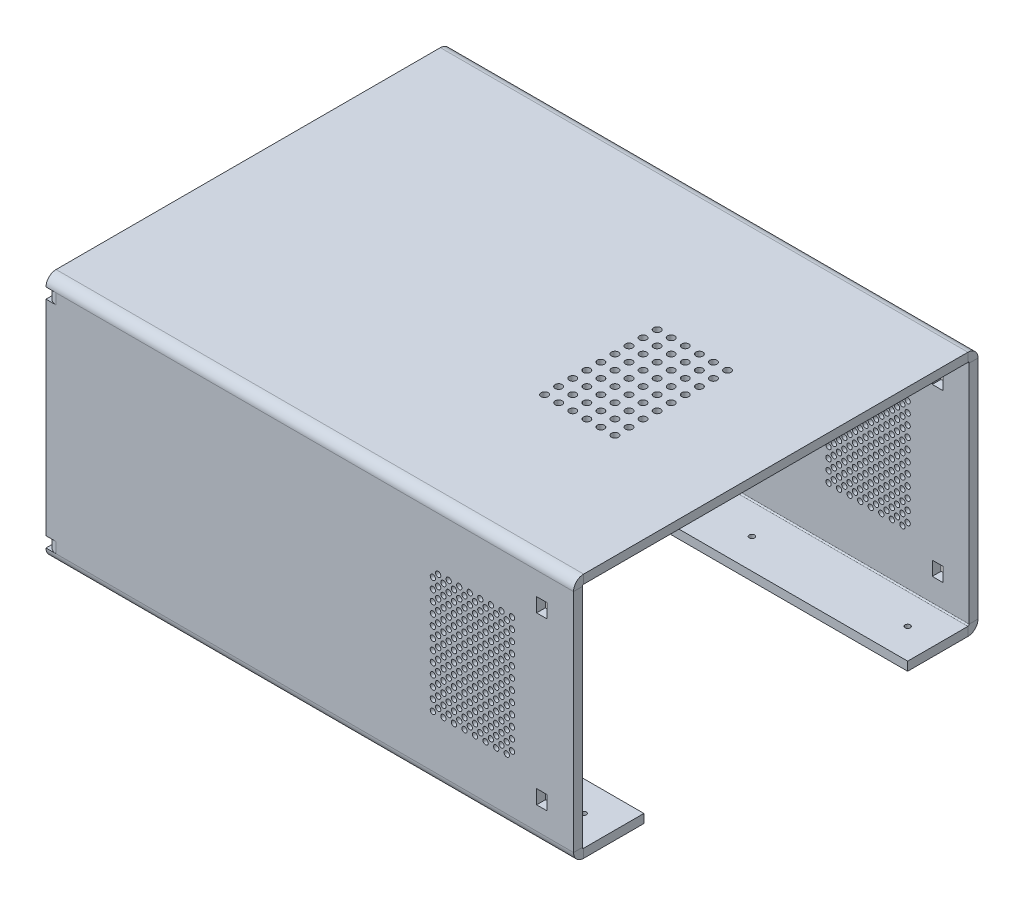
from build123d import *

# Parameters (mm, degrees)
SKETCH1_W                         = 300
SKETCH1_H                         = 220
TOP_SURFACE_DEPTH                 = 5
SIDES_STRIP_W                     = 21.4732
SIDES_STRIP_H                     = 5
SIDES_STRIP_CUT_DEPTH             = 300
SIDES_STRIP_2_W                   = 21.4732
SIDES_STRIP_2_H                   = 5
SIDES_STRIP_CUT_2_DEPTH           = 300
SIDES_DEPTH                       = 300
SIDES_BEND_DEPTH                  = 300
BOTTOM_SURFACES_STRIP_W           = 21.4732
BOTTOM_SURFACES_STRIP_H           = 5
BOTTOM_SURFACES_STRIP_CUT_DEPTH   = 300
BOTTOM_SURFACES_STRIP_2_W         = 21.4732
BOTTOM_SURFACES_STRIP_2_H         = 5
BOTTOM_SURFACES_STRIP_CUT_2_DEPTH = 300
BOTTOM_SURFACES_DEPTH             = 300
BOTTOM_SURFACES_BEND_DEPTH        = 300
SKETCH27_R                        = 1.5
SCREW_HOLES_BOTTOM_DEPTH          = 5
EDGE_FLANGE4_STRIP_W              = 21.4732
EDGE_FLANGE4_STRIP_H              = 5
EDGE_FLANGE4_STRIP_CUT_DEPTH      = 6
EDGE_FLANGE4_DEPTH                = 6
EDGE_FLANGE5_STRIP_W              = 21.4732
EDGE_FLANGE5_STRIP_H              = 5
EDGE_FLANGE5_STRIP_CUT_DEPTH      = 6
EDGE_FLANGE5_DEPTH                = 6
EDGE_FLANGE6_STRIP_W              = 21.4732
EDGE_FLANGE6_STRIP_H              = 5
EDGE_FLANGE6_STRIP_CUT_DEPTH      = 6
EDGE_FLANGE6_DEPTH                = 6
EDGE_FLANGE7_STRIP_W              = 21.4732
EDGE_FLANGE7_STRIP_H              = 5
EDGE_FLANGE7_STRIP_CUT_DEPTH      = 6
EDGE_FLANGE7_DEPTH                = 6
SKETCH40_R                        = 1.5
CUT_EXTRUDE3_DEPTH                = 5
SKETCH42_R                        = 1.5
SIDE_AIR_VENTS_DEPTH              = 404.112887415
SKETCH46_R                        = 2
TOP_AIR_VENTS_DEPTH               = 5
SNAP_HOOK_GROVES_REACH            = 405.113
SKETCH43_W                        = 6
SKETCH43_H                        = 8


# Sheet-metal steps are written as plain solids
with BuildPart() as part:
    # Sketch1 → Top Surface (new body)
    with BuildSketch(Plane(origin=(0, 0, 0), x_dir=(1, 0, 0), z_dir=(0, 1, 0))):
        with Locations((150, -110)):
            Rectangle(SKETCH1_W, SKETCH1_H)
    extrude(amount=-TOP_SURFACE_DEPTH)

    # Sides strip (across the edge) → Sides strip cut (cut)
    with BuildSketch(Plane(origin=(300, -5, 220), x_dir=(0, 0, -1), z_dir=(-1, 0, 0))):
        with Locations((-10, -2.5)):
            Rectangle(SIDES_STRIP_W, SIDES_STRIP_H)
    extrude(amount=SIDES_STRIP_CUT_DEPTH, mode=Mode.SUBTRACT)

    # Sides strip 2 (across the edge) → Sides strip cut 2 (cut)
    with BuildSketch(Plane(origin=(0, -5, 0), x_dir=(0, 0, 1), z_dir=(1, 0, 0))):
        with Locations((-10, -2.5)):
            Rectangle(SIDES_STRIP_2_W, SIDES_STRIP_2_H)
    extrude(amount=SIDES_STRIP_CUT_2_DEPTH, mode=Mode.SUBTRACT)

    # Sides section (across the edge) → Sides (add)
    with BuildSketch(Plane(origin=(300, -5, 220), x_dir=(0, 0, -1), z_dir=(-1, 0, 0))):
        with BuildLine():
            Line((-5, 0.7366), (-5, 135))
            Line((-5, 135), (0, 135))
            Line((0, 135), (0, 0.7366))
            ThreePointArc((0, 0.7366), (0.215745145, 0.215745145), (0.7366, 0))
            Line((0.7366, 0), (0.7366, -5))
            ThreePointArc((0.7366, -5), (-3.319788761, -3.319788761), (-5, 0.7366))
        make_face()
    extrude(amount=SIDES_DEPTH)

    # Sides section 2 (across the edge) → Sides bend (add)
    with BuildSketch(Plane(origin=(0, -5, 0), x_dir=(0, 0, 1), z_dir=(1, 0, 0))):
        with BuildLine():
            Line((-5, 0.7366), (-5, 135))
            Line((-5, 135), (0, 135))
            Line((0, 135), (0, 0.7366))
            ThreePointArc((0, 0.7366), (0.215745145, 0.215745145), (0.7366, 0))
            Line((0.7366, 0), (0.7366, -5))
            ThreePointArc((0.7366, -5), (-3.319788761, -3.319788761), (-5, 0.7366))
        make_face()
    extrude(amount=SIDES_BEND_DEPTH)

    # Bottom surfaces strip (across the edge) → Bottom surfaces strip cut (cut)
    with BuildSketch(Plane(origin=(300, -140, 220), x_dir=(0, 1, 0), z_dir=(-1, 0, 0))):
        with Locations((-5, -2.5)):
            Rectangle(BOTTOM_SURFACES_STRIP_W, BOTTOM_SURFACES_STRIP_H)
    extrude(amount=BOTTOM_SURFACES_STRIP_CUT_DEPTH, mode=Mode.SUBTRACT)

    # Bottom surfaces strip 2 (across the edge) → Bottom surfaces strip cut 2 (cut)
    with BuildSketch(Plane(origin=(0, -140, 0), x_dir=(0, 1, 0), z_dir=(1, 0, 0))):
        with Locations((-5, -2.5)):
            Rectangle(BOTTOM_SURFACES_STRIP_2_W, BOTTOM_SURFACES_STRIP_2_H)
    extrude(amount=BOTTOM_SURFACES_STRIP_CUT_2_DEPTH, mode=Mode.SUBTRACT)

    # Bottom surfaces section (across the edge) → Bottom surfaces (add)
    with BuildSketch(Plane(origin=(300, -140, 220), x_dir=(0, 1, 0), z_dir=(-1, 0, 0))):
        with BuildLine():
            Line((0, 0.7366), (0, 35))
            Line((0, 35), (5, 35))
            Line((5, 35), (5, 0.7366))
            ThreePointArc((5, 0.7366), (5.215745145, 0.215745145), (5.7366, 0))
            Line((5.7366, 0), (5.7366, -5))
            ThreePointArc((5.7366, -5), (1.680211239, -3.319788761), (0, 0.7366))
        make_face()
    extrude(amount=BOTTOM_SURFACES_DEPTH)

    # Bottom surfaces section 2 (across the edge) → Bottom surfaces bend (add)
    with BuildSketch(Plane(origin=(0, -140, 0), x_dir=(0, 1, 0), z_dir=(1, 0, 0))):
        with BuildLine():
            Line((0, 0.7366), (0, 35))
            Line((0, 35), (5, 35))
            Line((5, 35), (5, 0.7366))
            ThreePointArc((5, 0.7366), (5.215745145, 0.215745145), (5.7366, 0))
            Line((5.7366, 0), (5.7366, -5))
            ThreePointArc((5.7366, -5), (1.680211239, -3.319788761), (0, 0.7366))
        make_face()
    extrude(amount=BOTTOM_SURFACES_BEND_DEPTH)

    # Sketch27 → Screw Holes Bottom (cut)
    with BuildSketch(Plane(origin=(0, -135, 0), x_dir=(1, 0, 0), z_dir=(0, 1, 0))):
        with Locations(Location((17.1317, -17.8683, 0), (0, 0, 270))):
            Circle(SKETCH27_R)
        with Locations(Location((105.710566667, -17.8683, 0), (0, 0, 270))):
            Circle(SKETCH27_R)
        with Locations(Location((194.289433333, -17.8683, 0), (0, 0, 270))):
            Circle(SKETCH27_R)
        with Locations(Location((282.8683, -17.8683, 0), (0, 0, 270))):
            Circle(SKETCH27_R)
        with Locations(Location((17.1317, -202.1317, 0), (0, 0, 270))):
            Circle(SKETCH27_R)
        with Locations(Location((105.710566667, -202.1317, 0), (0, 0, 270))):
            Circle(SKETCH27_R)
        with Locations(Location((194.289433333, -202.1317, 0), (0, 0, 270))):
            Circle(SKETCH27_R)
        with Locations(Location((282.8683, -202.1317, 0), (0, 0, 270))):
            Circle(SKETCH27_R)
    extrude(amount=-SCREW_HOLES_BOTTOM_DEPTH, mode=Mode.SUBTRACT)

    # Edge-Flange4 strip (across the edge) → Edge-Flange4 strip cut (cut)
    with BuildSketch(Plane(origin=(0, -11.7366, 220), x_dir=(1, 0, 0), z_dir=(0, 1, 0))):
        with Locations((-5, -2.5)):
            Rectangle(EDGE_FLANGE4_STRIP_W, EDGE_FLANGE4_STRIP_H)
    extrude(amount=EDGE_FLANGE4_STRIP_CUT_DEPTH, mode=Mode.SUBTRACT)

    # Edge-Flange4 section (across the edge) → Edge-Flange4 (add)
    with BuildSketch(Plane(origin=(0, -11.7366, 220), x_dir=(1, 0, 0), z_dir=(0, 1, 0))):
        with BuildLine():
            Line((0, 0.7366), (0, 6))
            Line((0, 6), (5, 6))
            Line((5, 6), (5, 0.7366))
            ThreePointArc((5, 0.7366), (5.215745145, 0.215745145), (5.7366, 0))
            Line((5.7366, 0), (5.7366, -5))
            ThreePointArc((5.7366, -5), (1.680211239, -3.319788761), (0, 0.7366))
        make_face()
    extrude(amount=EDGE_FLANGE4_DEPTH)

    # Edge-Flange5 strip (across the edge) → Edge-Flange5 strip cut (cut)
    with BuildSketch(Plane(origin=(0, -134.2634, 220), x_dir=(1, 0, 0), z_dir=(0, 1, 0))):
        with Locations((-5, -2.5)):
            Rectangle(EDGE_FLANGE5_STRIP_W, EDGE_FLANGE5_STRIP_H)
    extrude(amount=EDGE_FLANGE5_STRIP_CUT_DEPTH, mode=Mode.SUBTRACT)

    # Edge-Flange5 section (across the edge) → Edge-Flange5 (add)
    with BuildSketch(Plane(origin=(0, -134.2634, 220), x_dir=(1, 0, 0), z_dir=(0, 1, 0))):
        with BuildLine():
            Line((0, 0.7366), (0, 6))
            Line((0, 6), (5, 6))
            Line((5, 6), (5, 0.7366))
            ThreePointArc((5, 0.7366), (5.215745145, 0.215745145), (5.7366, 0))
            Line((5.7366, 0), (5.7366, -5))
            ThreePointArc((5.7366, -5), (1.680211239, -3.319788761), (0, 0.7366))
        make_face()
    extrude(amount=EDGE_FLANGE5_DEPTH)

    # Edge-Flange6 strip (across the edge) → Edge-Flange6 strip cut (cut)
    with BuildSketch(Plane.XZ.offset(128.2634)):
        with Locations((-5, -2.5)):
            Rectangle(EDGE_FLANGE6_STRIP_W, EDGE_FLANGE6_STRIP_H)
    extrude(amount=EDGE_FLANGE6_STRIP_CUT_DEPTH, mode=Mode.SUBTRACT)

    # Edge-Flange6 section (across the edge) → Edge-Flange6 (add)
    with BuildSketch(Plane.XZ.offset(128.2634)):
        with BuildLine():
            Line((0, 0.7366), (0, 6))
            Line((0, 6), (5, 6))
            Line((5, 6), (5, 0.7366))
            ThreePointArc((5, 0.7366), (5.215745145, 0.215745145), (5.7366, 0))
            Line((5.7366, 0), (5.7366, -5))
            ThreePointArc((5.7366, -5), (1.680211239, -3.319788761), (0, 0.7366))
        make_face()
    extrude(amount=EDGE_FLANGE6_DEPTH)

    # Edge-Flange7 strip (across the edge) → Edge-Flange7 strip cut (cut)
    with BuildSketch(Plane.XZ.offset(5.7366)):
        with Locations((-5, -2.5)):
            Rectangle(EDGE_FLANGE7_STRIP_W, EDGE_FLANGE7_STRIP_H)
    extrude(amount=EDGE_FLANGE7_STRIP_CUT_DEPTH, mode=Mode.SUBTRACT)

    # Edge-Flange7 section (across the edge) → Edge-Flange7 (add)
    with BuildSketch(Plane.XZ.offset(5.7366)):
        with BuildLine():
            Line((0, 0.7366), (0, 6))
            Line((0, 6), (5, 6))
            Line((5, 6), (5, 0.7366))
            ThreePointArc((5, 0.7366), (5.215745145, 0.215745145), (5.7366, 0))
            Line((5.7366, 0), (5.7366, -5))
            ThreePointArc((5.7366, -5), (1.680211239, -3.319788761), (0, 0.7366))
        make_face()
    extrude(amount=EDGE_FLANGE7_DEPTH)

    # Sketch40 → Cut-Extrude3 (cut)
    with BuildSketch(Plane.ZY):
        with Locations((3.3683, -8.7366)):
            Circle(SKETCH40_R)
        with Locations((3.3683, -131.2634)):
            Circle(SKETCH40_R)
        with Locations((216.6317, -8.7366)):
            Circle(SKETCH40_R)
        with Locations((216.6317, -131.2634)):
            Circle(SKETCH40_R)
    extrude(amount=-CUT_EXTRUDE3_DEPTH, mode=Mode.SUBTRACT)

    # Sketch42 → Side Air Vents (cut, through all)
    with BuildSketch(Plane(origin=(0, 0, -5), x_dir=(-1, 0, 0), z_dir=(0, 0, -1))):
        with Locations(Location((-265, -35.7366, 0), (0, 0, 90))):
            Circle(SKETCH42_R)
        with Locations(Location((-259, -35.7366, 0), (0, 0, 90))):
            Circle(SKETCH42_R)
        with Locations(Location((-253, -35.7366, 0), (0, 0, 90))):
            Circle(SKETCH42_R)
        with Locations(Location((-247, -35.7366, 0), (0, 0, 90))):
            Circle(SKETCH42_R)
        with Locations(Location((-241, -35.7366, 0), (0, 0, 90))):
            Circle(SKETCH42_R)
        with Locations(Location((-235, -35.7366, 0), (0, 0, 90))):
            Circle(SKETCH42_R)
        with Locations(Location((-229, -35.7366, 0), (0, 0, 90))):
            Circle(SKETCH42_R)
        with Locations(Location((-223, -35.7366, 0), (0, 0, 90))):
            Circle(SKETCH42_R)
        with Locations(Location((-262, -38.7366, 0), (0, 0, 90))):
            Circle(SKETCH42_R)
        with Locations(Location((-256, -38.7366, 0), (0, 0, 90))):
            Circle(SKETCH42_R)
        with Locations(Location((-250, -38.7366, 0), (0, 0, 90))):
            Circle(SKETCH42_R)
        with Locations(Location((-244, -38.7366, 0), (0, 0, 90))):
            Circle(SKETCH42_R)
        with Locations(Location((-238, -38.7366, 0), (0, 0, 90))):
            Circle(SKETCH42_R)
        with Locations(Location((-232, -38.7366, 0), (0, 0, 90))):
            Circle(SKETCH42_R)
        with Locations(Location((-226, -38.7366, 0), (0, 0, 90))):
            Circle(SKETCH42_R)
        with Locations(Location((-220, -38.7366, 0), (0, 0, 90))):
            Circle(SKETCH42_R)
        with Locations(Location((-265, -41.7366, 0), (0, 0, 90))):
            Circle(SKETCH42_R)
        with Locations(Location((-259, -41.7366, 0), (0, 0, 90))):
            Circle(SKETCH42_R)
        with Locations(Location((-253, -41.7366, 0), (0, 0, 90))):
            Circle(SKETCH42_R)
        with Locations(Location((-247, -41.7366, 0), (0, 0, 90))):
            Circle(SKETCH42_R)
        with Locations(Location((-241, -41.7366, 0), (0, 0, 90))):
            Circle(SKETCH42_R)
        with Locations(Location((-235, -41.7366, 0), (0, 0, 90))):
            Circle(SKETCH42_R)
        with Locations(Location((-229, -41.7366, 0), (0, 0, 90))):
            Circle(SKETCH42_R)
        with Locations(Location((-223, -41.7366, 0), (0, 0, 90))):
            Circle(SKETCH42_R)
        with Locations(Location((-262, -44.7366, 0), (0, 0, 90))):
            Circle(SKETCH42_R)
        with Locations(Location((-256, -44.7366, 0), (0, 0, 90))):
            Circle(SKETCH42_R)
        with Locations(Location((-250, -44.7366, 0), (0, 0, 90))):
            Circle(SKETCH42_R)
        with Locations(Location((-244, -44.7366, 0), (0, 0, 90))):
            Circle(SKETCH42_R)
        with Locations(Location((-238, -44.7366, 0), (0, 0, 90))):
            Circle(SKETCH42_R)
        with Locations(Location((-232, -44.7366, 0), (0, 0, 90))):
            Circle(SKETCH42_R)
        with Locations(Location((-226, -44.7366, 0), (0, 0, 90))):
            Circle(SKETCH42_R)
        with Locations(Location((-220, -44.7366, 0), (0, 0, 90))):
            Circle(SKETCH42_R)
        with Locations(Location((-265, -47.7366, 0), (0, 0, 90))):
            Circle(SKETCH42_R)
        with Locations(Location((-259, -47.7366, 0), (0, 0, 90))):
            Circle(SKETCH42_R)
        with Locations(Location((-253, -47.7366, 0), (0, 0, 90))):
            Circle(SKETCH42_R)
        with Locations(Location((-247, -47.7366, 0), (0, 0, 90))):
            Circle(SKETCH42_R)
        with Locations(Location((-241, -47.7366, 0), (0, 0, 90))):
            Circle(SKETCH42_R)
        with Locations(Location((-235, -47.7366, 0), (0, 0, 90))):
            Circle(SKETCH42_R)
        with Locations(Location((-229, -47.7366, 0), (0, 0, 90))):
            Circle(SKETCH42_R)
        with Locations(Location((-223, -47.7366, 0), (0, 0, 90))):
            Circle(SKETCH42_R)
        with Locations(Location((-262, -50.7366, 0), (0, 0, 90))):
            Circle(SKETCH42_R)
        with Locations(Location((-256, -50.7366, 0), (0, 0, 90))):
            Circle(SKETCH42_R)
        with Locations(Location((-250, -50.7366, 0), (0, 0, 90))):
            Circle(SKETCH42_R)
        with Locations(Location((-244, -50.7366, 0), (0, 0, 90))):
            Circle(SKETCH42_R)
        with Locations(Location((-238, -50.7366, 0), (0, 0, 90))):
            Circle(SKETCH42_R)
        with Locations(Location((-232, -50.7366, 0), (0, 0, 90))):
            Circle(SKETCH42_R)
        with Locations(Location((-226, -50.7366, 0), (0, 0, 90))):
            Circle(SKETCH42_R)
        with Locations(Location((-220, -50.7366, 0), (0, 0, 90))):
            Circle(SKETCH42_R)
        with Locations(Location((-265, -53.7366, 0), (0, 0, 90))):
            Circle(SKETCH42_R)
        with Locations(Location((-259, -53.7366, 0), (0, 0, 90))):
            Circle(SKETCH42_R)
        with Locations(Location((-253, -53.7366, 0), (0, 0, 90))):
            Circle(SKETCH42_R)
        with Locations(Location((-247, -53.7366, 0), (0, 0, 90))):
            Circle(SKETCH42_R)
        with Locations(Location((-241, -53.7366, 0), (0, 0, 90))):
            Circle(SKETCH42_R)
        with Locations(Location((-235, -53.7366, 0), (0, 0, 90))):
            Circle(SKETCH42_R)
        with Locations(Location((-229, -53.7366, 0), (0, 0, 90))):
            Circle(SKETCH42_R)
        with Locations(Location((-223, -53.7366, 0), (0, 0, 90))):
            Circle(SKETCH42_R)
        with Locations(Location((-262, -56.7366, 0), (0, 0, 90))):
            Circle(SKETCH42_R)
        with Locations(Location((-256, -56.7366, 0), (0, 0, 90))):
            Circle(SKETCH42_R)
        with Locations(Location((-250, -56.7366, 0), (0, 0, 90))):
            Circle(SKETCH42_R)
        with Locations(Location((-244, -56.7366, 0), (0, 0, 90))):
            Circle(SKETCH42_R)
        with Locations(Location((-238, -56.7366, 0), (0, 0, 90))):
            Circle(SKETCH42_R)
        with Locations(Location((-232, -56.7366, 0), (0, 0, 90))):
            Circle(SKETCH42_R)
        with Locations(Location((-226, -56.7366, 0), (0, 0, 90))):
            Circle(SKETCH42_R)
        with Locations(Location((-220, -56.7366, 0), (0, 0, 90))):
            Circle(SKETCH42_R)
        with Locations(Location((-265, -59.7366, 0), (0, 0, 90))):
            Circle(SKETCH42_R)
        with Locations(Location((-259, -59.7366, 0), (0, 0, 90))):
            Circle(SKETCH42_R)
        with Locations(Location((-253, -59.7366, 0), (0, 0, 90))):
            Circle(SKETCH42_R)
        with Locations(Location((-247, -59.7366, 0), (0, 0, 90))):
            Circle(SKETCH42_R)
        with Locations(Location((-241, -59.7366, 0), (0, 0, 90))):
            Circle(SKETCH42_R)
        with Locations(Location((-235, -59.7366, 0), (0, 0, 90))):
            Circle(SKETCH42_R)
        with Locations(Location((-229, -59.7366, 0), (0, 0, 90))):
            Circle(SKETCH42_R)
        with Locations(Location((-223, -59.7366, 0), (0, 0, 90))):
            Circle(SKETCH42_R)
        with Locations(Location((-262, -62.7366, 0), (0, 0, 90))):
            Circle(SKETCH42_R)
        with Locations(Location((-256, -62.7366, 0), (0, 0, 90))):
            Circle(SKETCH42_R)
        with Locations(Location((-250, -62.7366, 0), (0, 0, 90))):
            Circle(SKETCH42_R)
        with Locations(Location((-244, -62.7366, 0), (0, 0, 90))):
            Circle(SKETCH42_R)
        with Locations(Location((-238, -62.7366, 0), (0, 0, 90))):
            Circle(SKETCH42_R)
        with Locations(Location((-232, -62.7366, 0), (0, 0, 90))):
            Circle(SKETCH42_R)
        with Locations(Location((-226, -62.7366, 0), (0, 0, 90))):
            Circle(SKETCH42_R)
        with Locations(Location((-220, -62.7366, 0), (0, 0, 90))):
            Circle(SKETCH42_R)
        with Locations(Location((-265, -65.7366, 0), (0, 0, 90))):
            Circle(SKETCH42_R)
        with Locations(Location((-259, -65.7366, 0), (0, 0, 90))):
            Circle(SKETCH42_R)
        with Locations(Location((-253, -65.7366, 0), (0, 0, 90))):
            Circle(SKETCH42_R)
        with Locations(Location((-247, -65.7366, 0), (0, 0, 90))):
            Circle(SKETCH42_R)
        with Locations(Location((-241, -65.7366, 0), (0, 0, 90))):
            Circle(SKETCH42_R)
        with Locations(Location((-235, -65.7366, 0), (0, 0, 90))):
            Circle(SKETCH42_R)
        with Locations(Location((-229, -65.7366, 0), (0, 0, 90))):
            Circle(SKETCH42_R)
        with Locations(Location((-223, -65.7366, 0), (0, 0, 90))):
            Circle(SKETCH42_R)
        with Locations(Location((-262, -68.7366, 0), (0, 0, 90))):
            Circle(SKETCH42_R)
        with Locations(Location((-256, -68.7366, 0), (0, 0, 90))):
            Circle(SKETCH42_R)
        with Locations(Location((-250, -68.7366, 0), (0, 0, 90))):
            Circle(SKETCH42_R)
        with Locations(Location((-244, -68.7366, 0), (0, 0, 90))):
            Circle(SKETCH42_R)
        with Locations(Location((-238, -68.7366, 0), (0, 0, 90))):
            Circle(SKETCH42_R)
        with Locations(Location((-232, -68.7366, 0), (0, 0, 90))):
            Circle(SKETCH42_R)
        with Locations(Location((-226, -68.7366, 0), (0, 0, 90))):
            Circle(SKETCH42_R)
        with Locations(Location((-220, -68.7366, 0), (0, 0, 90))):
            Circle(SKETCH42_R)
        with Locations(Location((-265, -71.7366, 0), (0, 0, 90))):
            Circle(SKETCH42_R)
        with Locations(Location((-259, -71.7366, 0), (0, 0, 90))):
            Circle(SKETCH42_R)
        with Locations(Location((-253, -71.7366, 0), (0, 0, 90))):
            Circle(SKETCH42_R)
        with Locations(Location((-247, -71.7366, 0), (0, 0, 90))):
            Circle(SKETCH42_R)
        with Locations(Location((-241, -71.7366, 0), (0, 0, 90))):
            Circle(SKETCH42_R)
        with Locations(Location((-235, -71.7366, 0), (0, 0, 90))):
            Circle(SKETCH42_R)
        with Locations(Location((-229, -71.7366, 0), (0, 0, 90))):
            Circle(SKETCH42_R)
        with Locations(Location((-223, -71.7366, 0), (0, 0, 90))):
            Circle(SKETCH42_R)
        with Locations(Location((-262, -74.7366, 0), (0, 0, 90))):
            Circle(SKETCH42_R)
        with Locations(Location((-256, -74.7366, 0), (0, 0, 90))):
            Circle(SKETCH42_R)
        with Locations(Location((-250, -74.7366, 0), (0, 0, 90))):
            Circle(SKETCH42_R)
        with Locations(Location((-244, -74.7366, 0), (0, 0, 90))):
            Circle(SKETCH42_R)
        with Locations(Location((-238, -74.7366, 0), (0, 0, 90))):
            Circle(SKETCH42_R)
        with Locations(Location((-232, -74.7366, 0), (0, 0, 90))):
            Circle(SKETCH42_R)
        with Locations(Location((-226, -74.7366, 0), (0, 0, 90))):
            Circle(SKETCH42_R)
        with Locations(Location((-220, -74.7366, 0), (0, 0, 90))):
            Circle(SKETCH42_R)
        with Locations(Location((-265, -77.7366, 0), (0, 0, 90))):
            Circle(SKETCH42_R)
        with Locations(Location((-259, -77.7366, 0), (0, 0, 90))):
            Circle(SKETCH42_R)
        with Locations(Location((-253, -77.7366, 0), (0, 0, 90))):
            Circle(SKETCH42_R)
        with Locations(Location((-247, -77.7366, 0), (0, 0, 90))):
            Circle(SKETCH42_R)
        with Locations(Location((-241, -77.7366, 0), (0, 0, 90))):
            Circle(SKETCH42_R)
        with Locations(Location((-235, -77.7366, 0), (0, 0, 90))):
            Circle(SKETCH42_R)
        with Locations(Location((-229, -77.7366, 0), (0, 0, 90))):
            Circle(SKETCH42_R)
        with Locations(Location((-223, -77.7366, 0), (0, 0, 90))):
            Circle(SKETCH42_R)
        with Locations(Location((-262, -80.7366, 0), (0, 0, 90))):
            Circle(SKETCH42_R)
        with Locations(Location((-256, -80.7366, 0), (0, 0, 90))):
            Circle(SKETCH42_R)
        with Locations(Location((-250, -80.7366, 0), (0, 0, 90))):
            Circle(SKETCH42_R)
        with Locations(Location((-244, -80.7366, 0), (0, 0, 90))):
            Circle(SKETCH42_R)
        with Locations(Location((-238, -80.7366, 0), (0, 0, 90))):
            Circle(SKETCH42_R)
        with Locations(Location((-232, -80.7366, 0), (0, 0, 90))):
            Circle(SKETCH42_R)
        with Locations(Location((-226, -80.7366, 0), (0, 0, 90))):
            Circle(SKETCH42_R)
        with Locations(Location((-220, -80.7366, 0), (0, 0, 90))):
            Circle(SKETCH42_R)
        with Locations(Location((-265, -83.7366, 0), (0, 0, 90))):
            Circle(SKETCH42_R)
        with Locations(Location((-259, -83.7366, 0), (0, 0, 90))):
            Circle(SKETCH42_R)
        with Locations(Location((-253, -83.7366, 0), (0, 0, 90))):
            Circle(SKETCH42_R)
        with Locations(Location((-247, -83.7366, 0), (0, 0, 90))):
            Circle(SKETCH42_R)
        with Locations(Location((-241, -83.7366, 0), (0, 0, 90))):
            Circle(SKETCH42_R)
        with Locations(Location((-235, -83.7366, 0), (0, 0, 90))):
            Circle(SKETCH42_R)
        with Locations(Location((-229, -83.7366, 0), (0, 0, 90))):
            Circle(SKETCH42_R)
        with Locations(Location((-223, -83.7366, 0), (0, 0, 90))):
            Circle(SKETCH42_R)
        with Locations(Location((-262, -86.7366, 0), (0, 0, 90))):
            Circle(SKETCH42_R)
        with Locations(Location((-256, -86.7366, 0), (0, 0, 90))):
            Circle(SKETCH42_R)
        with Locations(Location((-250, -86.7366, 0), (0, 0, 90))):
            Circle(SKETCH42_R)
        with Locations(Location((-244, -86.7366, 0), (0, 0, 90))):
            Circle(SKETCH42_R)
        with Locations(Location((-238, -86.7366, 0), (0, 0, 90))):
            Circle(SKETCH42_R)
        with Locations(Location((-232, -86.7366, 0), (0, 0, 90))):
            Circle(SKETCH42_R)
        with Locations(Location((-226, -86.7366, 0), (0, 0, 90))):
            Circle(SKETCH42_R)
        with Locations(Location((-220, -86.7366, 0), (0, 0, 90))):
            Circle(SKETCH42_R)
        with Locations(Location((-265, -89.7366, 0), (0, 0, 90))):
            Circle(SKETCH42_R)
        with Locations(Location((-259, -89.7366, 0), (0, 0, 90))):
            Circle(SKETCH42_R)
        with Locations(Location((-253, -89.7366, 0), (0, 0, 90))):
            Circle(SKETCH42_R)
        with Locations(Location((-247, -89.7366, 0), (0, 0, 90))):
            Circle(SKETCH42_R)
        with Locations(Location((-241, -89.7366, 0), (0, 0, 90))):
            Circle(SKETCH42_R)
        with Locations(Location((-235, -89.7366, 0), (0, 0, 90))):
            Circle(SKETCH42_R)
        with Locations(Location((-229, -89.7366, 0), (0, 0, 90))):
            Circle(SKETCH42_R)
        with Locations(Location((-223, -89.7366, 0), (0, 0, 90))):
            Circle(SKETCH42_R)
        with Locations(Location((-262, -92.7366, 0), (0, 0, 90))):
            Circle(SKETCH42_R)
        with Locations(Location((-256, -92.7366, 0), (0, 0, 90))):
            Circle(SKETCH42_R)
        with Locations(Location((-250, -92.7366, 0), (0, 0, 90))):
            Circle(SKETCH42_R)
        with Locations(Location((-244, -92.7366, 0), (0, 0, 90))):
            Circle(SKETCH42_R)
        with Locations(Location((-238, -92.7366, 0), (0, 0, 90))):
            Circle(SKETCH42_R)
        with Locations(Location((-232, -92.7366, 0), (0, 0, 90))):
            Circle(SKETCH42_R)
        with Locations(Location((-226, -92.7366, 0), (0, 0, 90))):
            Circle(SKETCH42_R)
        with Locations(Location((-220, -92.7366, 0), (0, 0, 90))):
            Circle(SKETCH42_R)
        with Locations(Location((-265, -95.7366, 0), (0, 0, 90))):
            Circle(SKETCH42_R)
        with Locations(Location((-259, -95.7366, 0), (0, 0, 90))):
            Circle(SKETCH42_R)
        with Locations(Location((-253, -95.7366, 0), (0, 0, 90))):
            Circle(SKETCH42_R)
        with Locations(Location((-247, -95.7366, 0), (0, 0, 90))):
            Circle(SKETCH42_R)
        with Locations(Location((-241, -95.7366, 0), (0, 0, 90))):
            Circle(SKETCH42_R)
        with Locations(Location((-235, -95.7366, 0), (0, 0, 90))):
            Circle(SKETCH42_R)
        with Locations(Location((-229, -95.7366, 0), (0, 0, 90))):
            Circle(SKETCH42_R)
        with Locations(Location((-223, -95.7366, 0), (0, 0, 90))):
            Circle(SKETCH42_R)
        with Locations(Location((-262, -98.7366, 0), (0, 0, 90))):
            Circle(SKETCH42_R)
        with Locations(Location((-256, -98.7366, 0), (0, 0, 90))):
            Circle(SKETCH42_R)
        with Locations(Location((-250, -98.7366, 0), (0, 0, 90))):
            Circle(SKETCH42_R)
        with Locations(Location((-244, -98.7366, 0), (0, 0, 90))):
            Circle(SKETCH42_R)
        with Locations(Location((-238, -98.7366, 0), (0, 0, 90))):
            Circle(SKETCH42_R)
        with Locations(Location((-232, -98.7366, 0), (0, 0, 90))):
            Circle(SKETCH42_R)
        with Locations(Location((-226, -98.7366, 0), (0, 0, 90))):
            Circle(SKETCH42_R)
        with Locations(Location((-220, -98.7366, 0), (0, 0, 90))):
            Circle(SKETCH42_R)
        with Locations(Location((-265, -101.7366, 0), (0, 0, 90))):
            Circle(SKETCH42_R)
        with Locations(Location((-259, -101.7366, 0), (0, 0, 90))):
            Circle(SKETCH42_R)
        with Locations(Location((-253, -101.7366, 0), (0, 0, 90))):
            Circle(SKETCH42_R)
        with Locations(Location((-247, -101.7366, 0), (0, 0, 90))):
            Circle(SKETCH42_R)
        with Locations(Location((-241, -101.7366, 0), (0, 0, 90))):
            Circle(SKETCH42_R)
        with Locations(Location((-235, -101.7366, 0), (0, 0, 90))):
            Circle(SKETCH42_R)
        with Locations(Location((-229, -101.7366, 0), (0, 0, 90))):
            Circle(SKETCH42_R)
        with Locations(Location((-223, -101.7366, 0), (0, 0, 90))):
            Circle(SKETCH42_R)
        with Locations(Location((-262, -104.7366, 0), (0, 0, 90))):
            Circle(SKETCH42_R)
        with Locations(Location((-256, -104.7366, 0), (0, 0, 90))):
            Circle(SKETCH42_R)
        with Locations(Location((-250, -104.7366, 0), (0, 0, 90))):
            Circle(SKETCH42_R)
        with Locations(Location((-244, -104.7366, 0), (0, 0, 90))):
            Circle(SKETCH42_R)
        with Locations(Location((-238, -104.7366, 0), (0, 0, 90))):
            Circle(SKETCH42_R)
        with Locations(Location((-232, -104.7366, 0), (0, 0, 90))):
            Circle(SKETCH42_R)
        with Locations(Location((-226, -104.7366, 0), (0, 0, 90))):
            Circle(SKETCH42_R)
        with Locations(Location((-220, -104.7366, 0), (0, 0, 90))):
            Circle(SKETCH42_R)
    extrude(amount=-SIDE_AIR_VENTS_DEPTH, mode=Mode.SUBTRACT)

    # Sketch46 → Top Air Vents (cut)
    with BuildSketch(Plane(origin=(0, 0, 0), x_dir=(1, 0, 0), z_dir=(0, 1, 0))):
        with Locations(Location((200.537347208, -78, 0), (0, 0, 270))):
            Circle(SKETCH46_R)
        with Locations(Location((200.537347208, -86, 0), (0, 0, 270))):
            Circle(SKETCH46_R)
        with Locations(Location((200.537347208, -94, 0), (0, 0, 270))):
            Circle(SKETCH46_R)
        with Locations(Location((200.537347208, -102, 0), (0, 0, 270))):
            Circle(SKETCH46_R)
        with Locations(Location((200.537347208, -110, 0), (0, 0, 270))):
            Circle(SKETCH46_R)
        with Locations(Location((200.537347208, -118, 0), (0, 0, 270))):
            Circle(SKETCH46_R)
        with Locations(Location((200.537347208, -126, 0), (0, 0, 270))):
            Circle(SKETCH46_R)
        with Locations(Location((200.537347208, -134, 0), (0, 0, 270))):
            Circle(SKETCH46_R)
        with Locations(Location((200.537347208, -142, 0), (0, 0, 270))):
            Circle(SKETCH46_R)
        with Locations(Location((208.537347208, -78, 0), (0, 0, 270))):
            Circle(SKETCH46_R)
        with Locations(Location((208.537347208, -86, 0), (0, 0, 270))):
            Circle(SKETCH46_R)
        with Locations(Location((208.537347208, -94, 0), (0, 0, 270))):
            Circle(SKETCH46_R)
        with Locations(Location((208.537347208, -102, 0), (0, 0, 270))):
            Circle(SKETCH46_R)
        with Locations(Location((208.537347208, -110, 0), (0, 0, 270))):
            Circle(SKETCH46_R)
        with Locations(Location((208.537347208, -118, 0), (0, 0, 270))):
            Circle(SKETCH46_R)
        with Locations(Location((208.537347208, -126, 0), (0, 0, 270))):
            Circle(SKETCH46_R)
        with Locations(Location((208.537347208, -134, 0), (0, 0, 270))):
            Circle(SKETCH46_R)
        with Locations(Location((208.537347208, -142, 0), (0, 0, 270))):
            Circle(SKETCH46_R)
        with Locations(Location((216.537347208, -78, 0), (0, 0, 270))):
            Circle(SKETCH46_R)
        with Locations(Location((216.537347208, -86, 0), (0, 0, 270))):
            Circle(SKETCH46_R)
        with Locations(Location((216.537347208, -94, 0), (0, 0, 270))):
            Circle(SKETCH46_R)
        with Locations(Location((216.537347208, -102, 0), (0, 0, 270))):
            Circle(SKETCH46_R)
        with Locations(Location((216.537347208, -110, 0), (0, 0, 270))):
            Circle(SKETCH46_R)
        with Locations(Location((216.537347208, -118, 0), (0, 0, 270))):
            Circle(SKETCH46_R)
        with Locations(Location((216.537347208, -126, 0), (0, 0, 270))):
            Circle(SKETCH46_R)
        with Locations(Location((216.537347208, -134, 0), (0, 0, 270))):
            Circle(SKETCH46_R)
        with Locations(Location((216.537347208, -142, 0), (0, 0, 270))):
            Circle(SKETCH46_R)
        with Locations(Location((224.537347208, -78, 0), (0, 0, 270))):
            Circle(SKETCH46_R)
        with Locations(Location((224.537347208, -86, 0), (0, 0, 270))):
            Circle(SKETCH46_R)
        with Locations(Location((224.537347208, -94, 0), (0, 0, 270))):
            Circle(SKETCH46_R)
        with Locations(Location((224.537347208, -102, 0), (0, 0, 270))):
            Circle(SKETCH46_R)
        with Locations(Location((224.537347208, -110, 0), (0, 0, 270))):
            Circle(SKETCH46_R)
        with Locations(Location((224.537347208, -118, 0), (0, 0, 270))):
            Circle(SKETCH46_R)
        with Locations(Location((224.537347208, -126, 0), (0, 0, 270))):
            Circle(SKETCH46_R)
        with Locations(Location((224.537347208, -134, 0), (0, 0, 270))):
            Circle(SKETCH46_R)
        with Locations(Location((224.537347208, -142, 0), (0, 0, 270))):
            Circle(SKETCH46_R)
        with Locations(Location((232.537347208, -78, 0), (0, 0, 270))):
            Circle(SKETCH46_R)
        with Locations(Location((232.537347208, -86, 0), (0, 0, 270))):
            Circle(SKETCH46_R)
        with Locations(Location((232.537347208, -94, 0), (0, 0, 270))):
            Circle(SKETCH46_R)
        with Locations(Location((232.537347208, -102, 0), (0, 0, 270))):
            Circle(SKETCH46_R)
        with Locations(Location((232.537347208, -110, 0), (0, 0, 270))):
            Circle(SKETCH46_R)
        with Locations(Location((232.537347208, -118, 0), (0, 0, 270))):
            Circle(SKETCH46_R)
        with Locations(Location((232.537347208, -126, 0), (0, 0, 270))):
            Circle(SKETCH46_R)
        with Locations(Location((232.537347208, -134, 0), (0, 0, 270))):
            Circle(SKETCH46_R)
        with Locations(Location((232.537347208, -142, 0), (0, 0, 270))):
            Circle(SKETCH46_R)
        with Locations(Location((240.537347208, -78, 0), (0, 0, 270))):
            Circle(SKETCH46_R)
        with Locations(Location((240.537347208, -86, 0), (0, 0, 270))):
            Circle(SKETCH46_R)
        with Locations(Location((240.537347208, -94, 0), (0, 0, 270))):
            Circle(SKETCH46_R)
        with Locations(Location((240.537347208, -102, 0), (0, 0, 270))):
            Circle(SKETCH46_R)
        with Locations(Location((240.537347208, -110, 0), (0, 0, 270))):
            Circle(SKETCH46_R)
        with Locations(Location((240.537347208, -118, 0), (0, 0, 270))):
            Circle(SKETCH46_R)
        with Locations(Location((240.537347208, -126, 0), (0, 0, 270))):
            Circle(SKETCH46_R)
        with Locations(Location((240.537347208, -134, 0), (0, 0, 270))):
            Circle(SKETCH46_R)
        with Locations(Location((240.537347208, -142, 0), (0, 0, 270))):
            Circle(SKETCH46_R)
    extrude(amount=-TOP_AIR_VENTS_DEPTH, mode=Mode.SUBTRACT)

    # Snap Hook Groves: up to this face of the body (flat: up to its plane)
    snap_hook_groves_end = Plane(part.part.faces().sort_by_distance((146.891912311, -69.99135232, -5))[0])
    # Sketch43 → Snap Hook Groves (cut, up to the picked face)
    with BuildSketch(Plane.XY.offset(225), mode=Mode.PRIVATE) as snap_hook_groves_sk1:
        with Locations((282, -22.7366)):
            Rectangle(SKETCH43_W, SKETCH43_H)
    snap_hook_groves_tool1 = split(extrude(snap_hook_groves_sk1.sketch, amount=-SNAP_HOOK_GROVES_REACH, mode=Mode.PRIVATE), bisect_by=snap_hook_groves_end, keep=Keep.BOTH, mode=Mode.PRIVATE)
    # Sketch43 → Snap Hook Groves (cut, up to the picked face)
    with BuildSketch(Plane.XY.offset(225), mode=Mode.PRIVATE) as snap_hook_groves_sk2:
        with Locations((282, -117.2634)):
            Rectangle(SKETCH43_W, SKETCH43_H)
    snap_hook_groves_tool2 = split(extrude(snap_hook_groves_sk2.sketch, amount=-SNAP_HOOK_GROVES_REACH, mode=Mode.PRIVATE), bisect_by=snap_hook_groves_end, keep=Keep.BOTH, mode=Mode.PRIVATE)
    add(snap_hook_groves_tool1.solids().sort_by(Axis((282, -22.7366, 225), (0, 0, -1)))[0], mode=Mode.SUBTRACT)
    add(snap_hook_groves_tool2.solids().sort_by(Axis((282, -117.2634, 225), (0, 0, -1)))[0], mode=Mode.SUBTRACT)


solid = part.part
